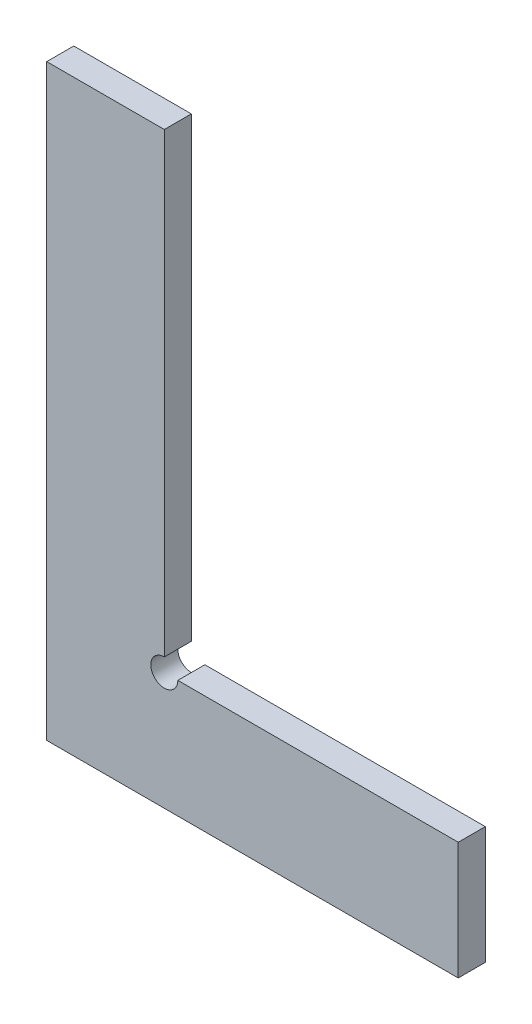
from build123d import *
from build123d.topology import SkipClean

# Parameters (mm, degrees)
Y_KSEKLIK_EKSTR_ZYON1_DEPTH = 4.6
IZIM3_R                     = 1.5
KES_EKSTR_ZYON1_DEPTH       = 4.4
DI_1_PITCH                  = 0.6
DI_2_PITCH                  = 0.6


with BuildPart() as part:
    # Çizim1 → Yükseklik-Ekstrüzyon1 (new body)
    with BuildSketch(Plane.XY):
        with BuildLine():
            Line((0, 0), (0, 100))
            Line((0, 100), (20, 100))
            Line((20, 100), (20, 22.3))
            ThreePointArc((20, 22.3), (18.373654403, 18.373654403), (22.3, 20))
            Line((22.3, 20), (70, 20))
            Line((70, 20), (70, 0))
            Line((70, 0), (0, 0))
        make_face()
    extrude(amount=Y_KSEKLIK_EKSTR_ZYON1_DEPTH)

    # Çizim3 → Kes-Ekstrüzyon1 (cut)
    with BuildSketch(Plane.XZ):
        with Locations(Location((11.5, 2.3, 0), (0, 0, 270))):
            Circle(IZIM3_R)
        with Locations(Location((58.5, 2.3, 0), (0, 0, 270))):
            Circle(IZIM3_R)
    extrude(amount=-KES_EKSTR_ZYON1_DEPTH, mode=Mode.SUBTRACT)

    # Diş1: the profile of Thread Profile1 profile screwed along a right-hand helix of 7.333333 turns, 6 arcs to a turn; built about Z, then put on its axis
    with SkipClean():  # the faces are left unmerged after this step: merging them gives an invalid solid
        di_1_z = Axis((0, 0, 0), (0, 0, 1))
        di_1_corners = [(1.4997, 0, -0.000173205), (1.824759525, 0, 0.187499999), (1.824759525, 0, 0.262499999), (1.4997, 0, 0.450173203)]
        with BuildLine(mode=Mode.PRIVATE) as di_1_profile:
            Line(di_1_corners[0], di_1_corners[1])
            Line(di_1_corners[1], di_1_corners[2])
            Line(di_1_corners[2], di_1_corners[3])
            Line(di_1_corners[3], di_1_corners[0])
        di_1_cap = Face(di_1_profile.wire())
        di_1_turn_angles = [0, 30, 60, 90, 120, 150, 180, 210, 240, 270, 300, 330, 360]
        di_1_turn_weights = [1, 0.8660254037844387, 1, 0.8660254037844387, 1, 0.8660254037844387, 1, 0.8660254037844387, 1, 0.8660254037844387, 1, 0.8660254037844387, 1]
        di_1_turn_rails = [Edge.make_bspline([Vector(p[0], p[1], 0).rotate(di_1_z, di_1_turn_angles[k]) / di_1_turn_weights[k] + Vector(0, 0, p[2] + DI_1_PITCH * di_1_turn_angles[k] / 360) for k in range(13)], [0, 0, 0, 1, 1, 2, 2, 3, 3, 4, 4, 5, 5, 6, 6, 6], 2, di_1_turn_weights) for p in di_1_corners]
        di_1_turn_sides = [Face.make_surface_from_curves(di_1_turn_rails[p[0]], di_1_turn_rails[p[1]]) for p in [(0, 1), (1, 2), (2, 3), (3, 0)]]
        di_1_last_angles = [2520, 2550, 2580, 2610, 2640]
        di_1_last_weights = [1, 0.8660254037844387, 1, 0.8660254037844367, 1]
        di_1_last_rails = [Edge.make_bspline([Vector(p[0], p[1], 0).rotate(di_1_z, di_1_last_angles[k]) / di_1_last_weights[k] + Vector(0, 0, p[2] + DI_1_PITCH * di_1_last_angles[k] / 360) for k in range(5)], [0, 0, 0, 1, 1, 2, 2, 2], 2, di_1_last_weights) for p in di_1_corners]
        di_1_last_sides = [Face.make_surface_from_curves(di_1_last_rails[p[0]], di_1_last_rails[p[1]]) for p in [(0, 1), (1, 2), (2, 3), (3, 0)]]
        di_1 = Plane(origin=(11.5, 0, 2.3), x_dir=(1, 0, 0), z_dir=(0, 1, 0)) * Solid(Shell([*[p.moved(Location((0, 0, DI_1_PITCH * i))) for i in range(7) for p in di_1_turn_sides], *di_1_last_sides, di_1_cap, di_1_cap.rotate(di_1_z, 2640).moved(Location((0, 0, DI_1_PITCH * 2640 / 360)))]))
        add(di_1, mode=Mode.SUBTRACT)

    # Diş2: the profile of Thread Profile2 profile screwed along a right-hand helix of 7.333333 turns, 6 arcs to a turn; built about Z, then put on its axis
    with SkipClean():  # the faces are left unmerged after this step: merging them gives an invalid solid
        di_2_z = Axis((0, 0, 0), (0, 0, 1))
        di_2_corners = [(1.4997, 0, -0.000173205), (1.824759525, 0, 0.187499999), (1.824759525, 0, 0.262499999), (1.4997, 0, 0.450173203)]
        with BuildLine(mode=Mode.PRIVATE) as di_2_profile:
            Line(di_2_corners[0], di_2_corners[1])
            Line(di_2_corners[1], di_2_corners[2])
            Line(di_2_corners[2], di_2_corners[3])
            Line(di_2_corners[3], di_2_corners[0])
        di_2_cap = Face(di_2_profile.wire())
        di_2_turn_angles = [0, 30, 60, 90, 120, 150, 180, 210, 240, 270, 300, 330, 360]
        di_2_turn_weights = [1, 0.8660254037844387, 1, 0.8660254037844387, 1, 0.8660254037844387, 1, 0.8660254037844387, 1, 0.8660254037844387, 1, 0.8660254037844387, 1]
        di_2_turn_rails = [Edge.make_bspline([Vector(p[0], p[1], 0).rotate(di_2_z, di_2_turn_angles[k]) / di_2_turn_weights[k] + Vector(0, 0, p[2] + DI_2_PITCH * di_2_turn_angles[k] / 360) for k in range(13)], [0, 0, 0, 1, 1, 2, 2, 3, 3, 4, 4, 5, 5, 6, 6, 6], 2, di_2_turn_weights) for p in di_2_corners]
        di_2_turn_sides = [Face.make_surface_from_curves(di_2_turn_rails[p[0]], di_2_turn_rails[p[1]]) for p in [(0, 1), (1, 2), (2, 3), (3, 0)]]
        di_2_last_angles = [2520, 2550, 2580, 2610, 2640]
        di_2_last_weights = [1, 0.8660254037844387, 1, 0.8660254037844367, 1]
        di_2_last_rails = [Edge.make_bspline([Vector(p[0], p[1], 0).rotate(di_2_z, di_2_last_angles[k]) / di_2_last_weights[k] + Vector(0, 0, p[2] + DI_2_PITCH * di_2_last_angles[k] / 360) for k in range(5)], [0, 0, 0, 1, 1, 2, 2, 2], 2, di_2_last_weights) for p in di_2_corners]
        di_2_last_sides = [Face.make_surface_from_curves(di_2_last_rails[p[0]], di_2_last_rails[p[1]]) for p in [(0, 1), (1, 2), (2, 3), (3, 0)]]
        di_2 = Plane(origin=(58.5, 0, 2.3), x_dir=(1, 0, 0), z_dir=(0, 1, 0)) * Solid(Shell([*[p.moved(Location((0, 0, DI_2_PITCH * i))) for i in range(7) for p in di_2_turn_sides], *di_2_last_sides, di_2_cap, di_2_cap.rotate(di_2_z, 2640).moved(Location((0, 0, DI_2_PITCH * 2640 / 360)))]))
        add(di_2, mode=Mode.SUBTRACT)


solid = part.part
